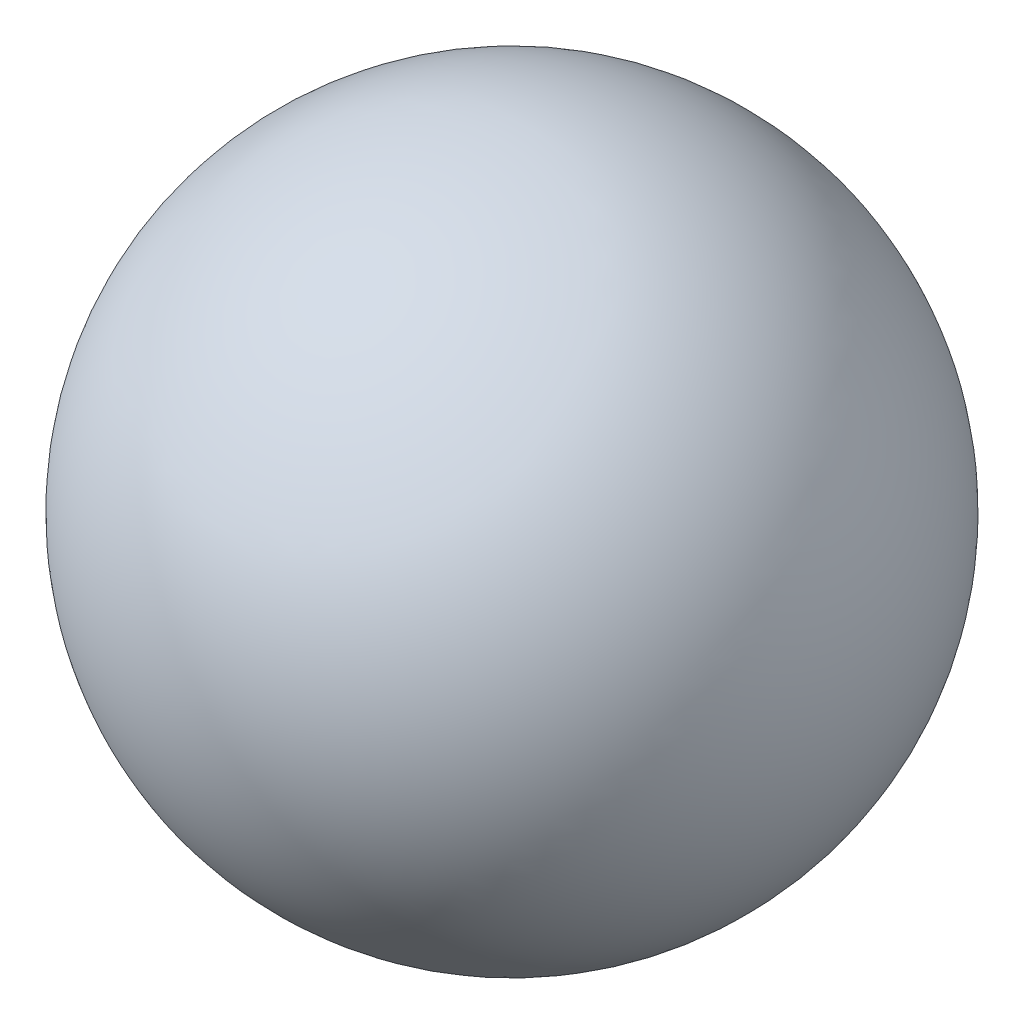
from build123d import *


with BuildPart() as part:
    # Эскиз8 → Шарик 14.5мм (revolve)
    with BuildSketch(Plane(origin=(0, 0, 0), x_dir=(1, 0, 0), z_dir=(0, 1, 0))):
        with BuildLine():
            Line((0, 7.25), (0, -7.25))
            ThreePointArc((0, -7.25), (7.25, 0), (0, 7.25))
        make_face()
    revolve(axis=Axis((0, 0, -7.25), (0, 0, 1)))


solid = part.part
